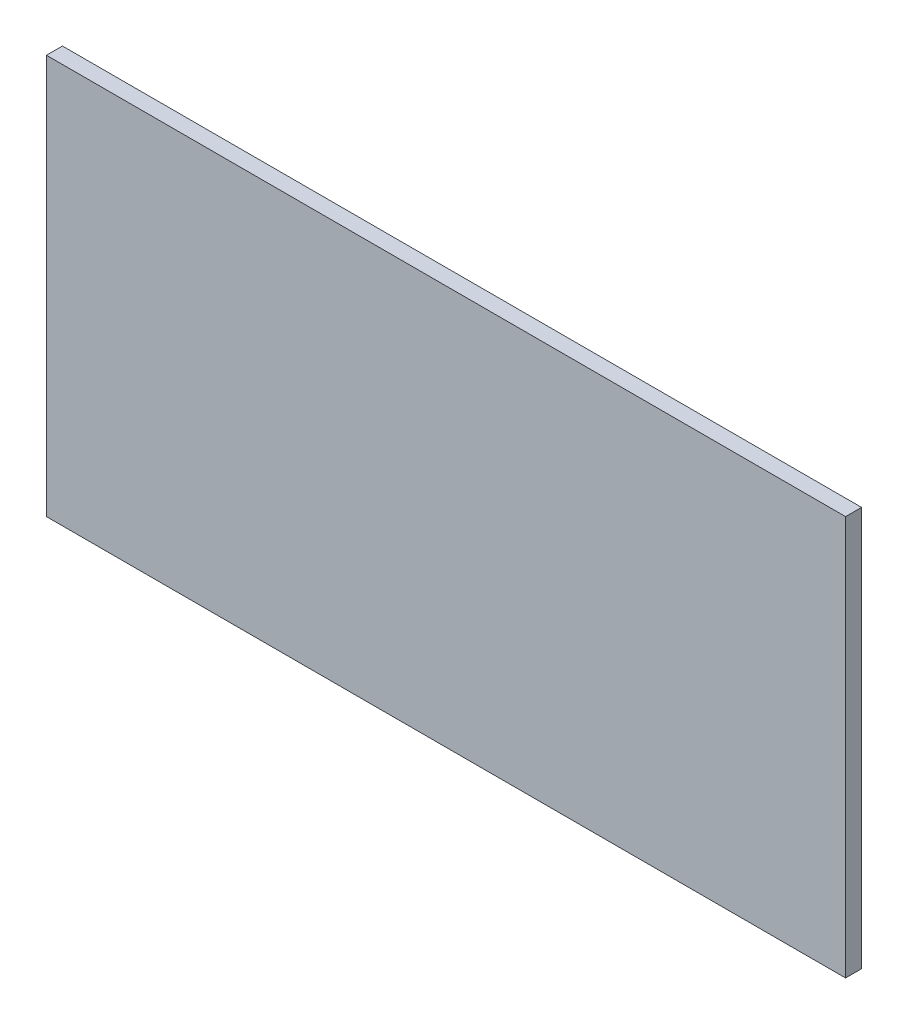
from build123d import *

# Parameters (mm, degrees)
SKETCH_1_W             = 100
SKETCH_1_H             = 50
SM_BASE_FLANGE_1_DEPTH = 2


# Sheet-metal steps are written as plain solids
with BuildPart() as part:
    # Sketch 1 → Базовая кромка1 (new body)
    with BuildSketch(Plane.XY):
        Rectangle(SKETCH_1_W, SKETCH_1_H)
    extrude(amount=-SM_BASE_FLANGE_1_DEPTH)


solid = part.part
